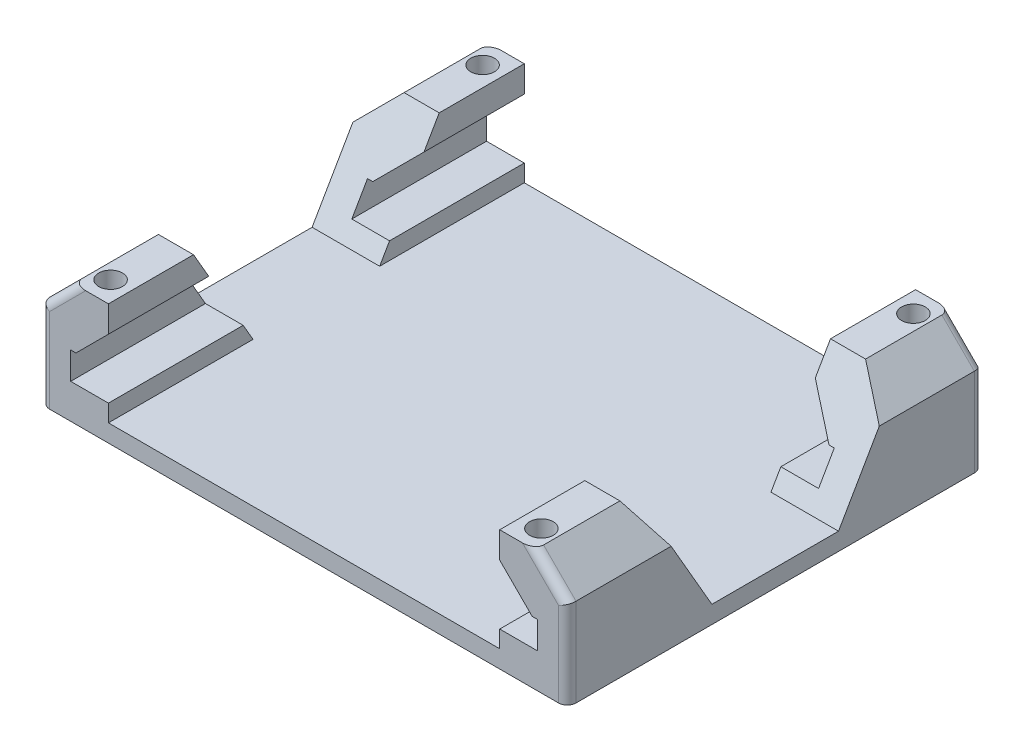
from build123d import *

# Parameters (mm, degrees)
BOSS_EXTRUDE1_DEPTH   = 46.39999966
SKETCH2_R             = 1.35
CUT_EXTRUDE1_DEPTH    = 57.705554564
CUT_EXTRUDE2_DEPTH    = 57.705554564
CUT_EXTRUDE3_DEPTH    = 77.912417193
MOVE_FACE1_BY         = 0.5
MOVE_FACE1_2_BY       = 0.5
CUT_EXTRUDE5_DEPTH    = 0.5
CUT_EXTRUDE6_DEPTH    = 0.5
MOVE_START            = 2.95
MOVE_FACE2_OUTLINE_W  = 4.2
MOVE_FACE2_OUTLINE_H  = 47.39999966
MOVE_FACE2_OUTLINE_R  = 1.35
MOVE_FACE2_DEPTH      = 2
MOVE_FACE3_BY         = 2
MOVE_FACE4_BY         = 0.1
MOVE_FACE4_2_BY       = 0.1
MOVE_FACE4_3_BY       = 0.1
MOVE_FACE4_4_BY       = 0.1
SKETCH14_W            = 31.645569848
SKETCH14_H            = 25
BOSS_EXTRUDE4_DEPTH   = 4
SKETCH15_R            = 2.1
CUT_EXTRUDE9_DEPTH    = 59.746648569
SKETCH16_R            = 3.6
CUT_EXTRUDE10_DEPTH   = 4.2
MOVE_FACE5_BY         = 4
MOVE_FACE6_BY         = 1
FILLET1_R             = 1
DELETEFACE1_START     = -5
DELETEFACE1_OUTLINE_R = 3.6
DELETEFACE1_DEPTH     = 6
DELETEFACE2_START     = -5
DELETEFACE2_OUTLINE_R = 1.35
DELETEFACE2_DEPTH     = 7.95
MOVE_FACE7_BY         = 4


# Read off the part's stored shape, not the designer's step: Move Face2, DeleteFace1, DeleteFace2
with BuildPart() as part:
    # Sketch1 → Boss-Extrude1 (new body)
    with BuildSketch(Plane.XY):
        Polygon((0, 0), (30, 0), (30, 12.7499), (22.3001, 12.7499), (22.3001, 9.7499), (26, 6.05), (26, 4.95), (22.3, 4.95), (22.3, 1), (0, 1), align=None)
    extrude(amount=-BOSS_EXTRUDE1_DEPTH)

    # Mirror1: part across plane


with BuildPart() as part_1:
    add(part.part)
    add(part.part.mirror(Plane(origin=(0, 1, -46.39999966), x_dir=(0, 0, 1), z_dir=(-1, 0, 0))))

    # Sketch2 → Cut-Extrude1 (cut, through all)
    with BuildSketch(Plane(origin=(0, 12.7499, 0), x_dir=(1, 0, 0), z_dir=(0, 1, 0))):
        with Locations(Location((-24.549999831, 1.999999999, 0), (0, 0, 270))):
            Circle(SKETCH2_R)
        with Locations(Location((-24.549999831, 44.399999661, 0), (0, 0, 270))):
            Circle(SKETCH2_R)
        with Locations(Location((24.549999831, 1.999999999, 0), (0, 0, 270))):
            Circle(SKETCH2_R)
        with Locations(Location((24.549999831, 44.399999661, 0), (0, 0, 270))):
            Circle(SKETCH2_R)
    extrude(amount=-CUT_EXTRUDE1_DEPTH, mode=Mode.SUBTRACT)

    # Sketch3 → Cut-Extrude2 (cut, through all)
    with BuildSketch(Plane.XY):
        Polygon((26.3, 12.7499), (30, 9.0499), (30, 12.7499), align=None)
        Polygon((-30, 12.7499), (-30, 9.0499), (-26.3, 12.7499), align=None)
    extrude(amount=-CUT_EXTRUDE2_DEPTH, mode=Mode.SUBTRACT)

    # Sketch4 → Cut-Extrude3 (cut, through all)
    with BuildSketch(Plane(origin=(30, 0, 0), x_dir=(0, 0, -1), z_dir=(1, 0, 0))):
        Polygon((9.19999983, 12.7499), (37.19999983, 12.7499), (30.416191902, 1), (15.983807758, 1), align=None)
    extrude(amount=-CUT_EXTRUDE3_DEPTH, mode=Mode.SUBTRACT)

    # Move Face1: a face moved outward by 0.5
    extrude(part_1.faces().sort_by_distance((-24, 3.187475, -46.39999966))[0], amount=MOVE_FACE1_BY, dir=(0, 0, -1))

    # Move Face1 2: a face moved outward by 0.5
    extrude(part_1.faces().sort_by_distance((-24, 3.187475, 0))[0], amount=MOVE_FACE1_2_BY, dir=(0, 0, 1))

    # Sketch6 → Cut-Extrude5 (cut)
    with BuildSketch(Plane(origin=(-26, 0, 0), x_dir=(0, 0, -1), z_dir=(1, 0, 0))):
        Polygon((13.703274195, 4.95), (13.068188899, 6.05), (-0.5, 6.05), (-0.5, 4.95), align=None)
        Polygon((33.331810761, 6.05), (32.696725465, 4.95), (46.89999966, 4.95), (46.89999966, 6.05), align=None)
    extrude(amount=-CUT_EXTRUDE5_DEPTH, mode=Mode.SUBTRACT)

    # Sketch7 → Cut-Extrude6 (cut)
    with BuildSketch(Plane.ZY.offset(-26)):
        Polygon((-13.068188899, 6.05), (-13.703274195, 4.95), (0.5, 4.95), (0.5, 6.05), align=None)
        Polygon((-32.696725465, 4.95), (-33.331810761, 6.05), (-46.89999966, 6.05), (-46.89999966, 4.95), align=None)
    extrude(amount=-CUT_EXTRUDE6_DEPTH, mode=Mode.SUBTRACT)

    # Move Face2 outline → Move Face2 (cut)
    # profile 1 of 2: a face of its own
    with BuildSketch(Plane(origin=(0, 0, 0), x_dir=(1, 0, 0), z_dir=(0, 1, 0)).offset(MOVE_START)):
        with Locations((-24.4, 23.19999983)):
            Rectangle(MOVE_FACE2_OUTLINE_W, MOVE_FACE2_OUTLINE_H)
        with Locations((-24.549999831, 1.999999999)):
            Circle(MOVE_FACE2_OUTLINE_R, mode=Mode.SUBTRACT)
        with Locations((-24.549999831, 44.399999661)):
            Circle(MOVE_FACE2_OUTLINE_R, mode=Mode.SUBTRACT)
    # profile 2 of 2: a face of its own
    with BuildSketch(Plane(origin=(0, 0, 0), x_dir=(1, 0, 0), z_dir=(0, 1, 0)).offset(MOVE_START)):
        with Locations((24.4, 23.19999983)):
            Rectangle(MOVE_FACE2_OUTLINE_W, MOVE_FACE2_OUTLINE_H)
        with Locations((24.549999831, 1.999999999)):
            Circle(MOVE_FACE2_OUTLINE_R, mode=Mode.SUBTRACT)
        with Locations((24.549999831, 44.399999661)):
            Circle(MOVE_FACE2_OUTLINE_R, mode=Mode.SUBTRACT)
    extrude(amount=MOVE_FACE2_DEPTH, mode=Mode.SUBTRACT)

    # Move Face3: a face moved outward by 2.0
    extrude(part_1.faces().sort_by_distance((0, 0, -23.19999983))[0], amount=MOVE_FACE3_BY, dir=(0, -1, 0))

    # Move Face4: a face moved inward by 0.1
    extrude(part_1.faces().sort_by_distance((-26.5, 4.468031617, -6.740769385))[0], amount=MOVE_FACE4_BY, dir=(-1, 0, 0), mode=Mode.SUBTRACT)

    # Move Face4 2: a face moved inward by 0.1
    extrude(part_1.faces().sort_by_distance((-26.5, 4.468031617, -39.659230275))[0], amount=MOVE_FACE4_2_BY, dir=(-1, 0, 0), mode=Mode.SUBTRACT)

    # Move Face4 3: a face moved inward by 0.1
    extrude(part_1.faces().sort_by_distance((26.5, 4.468031617, -6.740769385))[0], amount=MOVE_FACE4_3_BY, dir=(1, 0, 0), mode=Mode.SUBTRACT)

    # Move Face4 4: a face moved inward by 0.1
    extrude(part_1.faces().sort_by_distance((26.5, 4.468031617, -39.659230275))[0], amount=MOVE_FACE4_4_BY, dir=(1, 0, 0), mode=Mode.SUBTRACT)

    # Sketch14 → Boss-Extrude4 (add)
    with BuildSketch(Plane.XZ.offset(2)):
        with Locations((0, -23.19999983)):
            Rectangle(SKETCH14_W, SKETCH14_H)
    extrude(amount=BOSS_EXTRUDE4_DEPTH)

    # Sketch15 → Cut-Extrude9 (cut, through all)
    with BuildSketch(Plane.XZ.offset(6)):
        with Locations(Location((-8.5, -14.69999983, 0), (0, 0, 270))):
            Circle(SKETCH15_R)
        with Locations(Location((8.5, -14.69999983, 0), (0, 0, 270))):
            Circle(SKETCH15_R)
        with Locations(Location((8.5, -31.69999983, 0), (0, 0, 270))):
            Circle(SKETCH15_R)
        with Locations(Location((-8.5, -31.69999983, 0), (0, 0, 270))):
            Circle(SKETCH15_R)
    extrude(amount=-CUT_EXTRUDE9_DEPTH, mode=Mode.SUBTRACT)

    # Sketch16 → Cut-Extrude10 (cut)
    with BuildSketch(Plane(origin=(0, 1, 0), x_dir=(1, 0, 0), z_dir=(0, 1, 0))):
        with Locations(Location((-8.5, 31.69999983, 0), (0, 0, 270))):
            Circle(SKETCH16_R)
        with Locations(Location((8.5, 31.69999983, 0), (0, 0, 270))):
            Circle(SKETCH16_R)
        with Locations(Location((8.5, 14.69999983, 0), (0, 0, 270))):
            Circle(SKETCH16_R)
        with Locations(Location((-8.5, 14.69999983, 0), (0, 0, 270))):
            Circle(SKETCH16_R)
    extrude(amount=-CUT_EXTRUDE10_DEPTH, mode=Mode.SUBTRACT)

    # Move Face5: a face moved outward by 4.0
    extrude(part_1.faces().sort_by_distance((0, -2, -42.159999694))[0], amount=MOVE_FACE5_BY, dir=(0, -1, 0))

    # Move Face6: a face moved inward by 1.0
    extrude(part_1.faces().sort_by_distance((0, -6, -23.19999983))[0], amount=MOVE_FACE6_BY, dir=(0, 1, 0), mode=Mode.SUBTRACT)

    # Fillet1
    fillet1_edges = [part_1.edges().sort_by_distance(p)[0] for p in [
        (30, 2.02495, -46.89999966),
        (30, 2.02495, 0.5),
        (-30, 2.02495, 0.5),
        (-30, 2.02495, -46.89999966),
        (28.15, 10.8999, -46.89999966),
        (28.15, 10.8999, 0.5),
        (-28.15, 10.8999, -46.89999966),
        (-28.15, 10.8999, 0.5),
    ]]
    fillet(fillet1_edges, radius=FILLET1_R)

    # DeleteFace1 outline → DeleteFace1 (add)
    with BuildSketch(Plane(origin=(0, 0, 0), x_dir=(1, 0, 0), z_dir=(0, 1, 0)).offset(DELETEFACE1_START)):
        with Locations((-8.5, 14.69999983)):
            Circle(DELETEFACE1_OUTLINE_R)
        with Locations((8.5, 14.69999983)):
            Circle(DELETEFACE1_OUTLINE_R)
        with Locations((8.5, 31.69999983)):
            Circle(DELETEFACE1_OUTLINE_R)
        with Locations((-8.5, 31.69999983)):
            Circle(DELETEFACE1_OUTLINE_R)
    extrude(amount=DELETEFACE1_DEPTH)

    # DeleteFace2 outline → DeleteFace2 (add)
    with BuildSketch(Plane(origin=(0, 0, 0), x_dir=(1, 0, 0), z_dir=(0, 1, 0)).offset(DELETEFACE2_START)):
        with Locations((-24.549999831, 1.999999999)):
            Circle(DELETEFACE2_OUTLINE_R)
        with Locations((-24.549999831, 44.399999661)):
            Circle(DELETEFACE2_OUTLINE_R)
        with Locations((24.549999831, 1.999999999)):
            Circle(DELETEFACE2_OUTLINE_R)
        with Locations((24.549999831, 44.399999661)):
            Circle(DELETEFACE2_OUTLINE_R)
    extrude(amount=DELETEFACE2_DEPTH)

    # Move Face7: a face moved inward by 4.0
    extrude(part_1.faces().sort_by_distance((0, -5, -23.19999983))[0], amount=MOVE_FACE7_BY, dir=(0, 1, 0), mode=Mode.SUBTRACT)


solid = part_1.part
